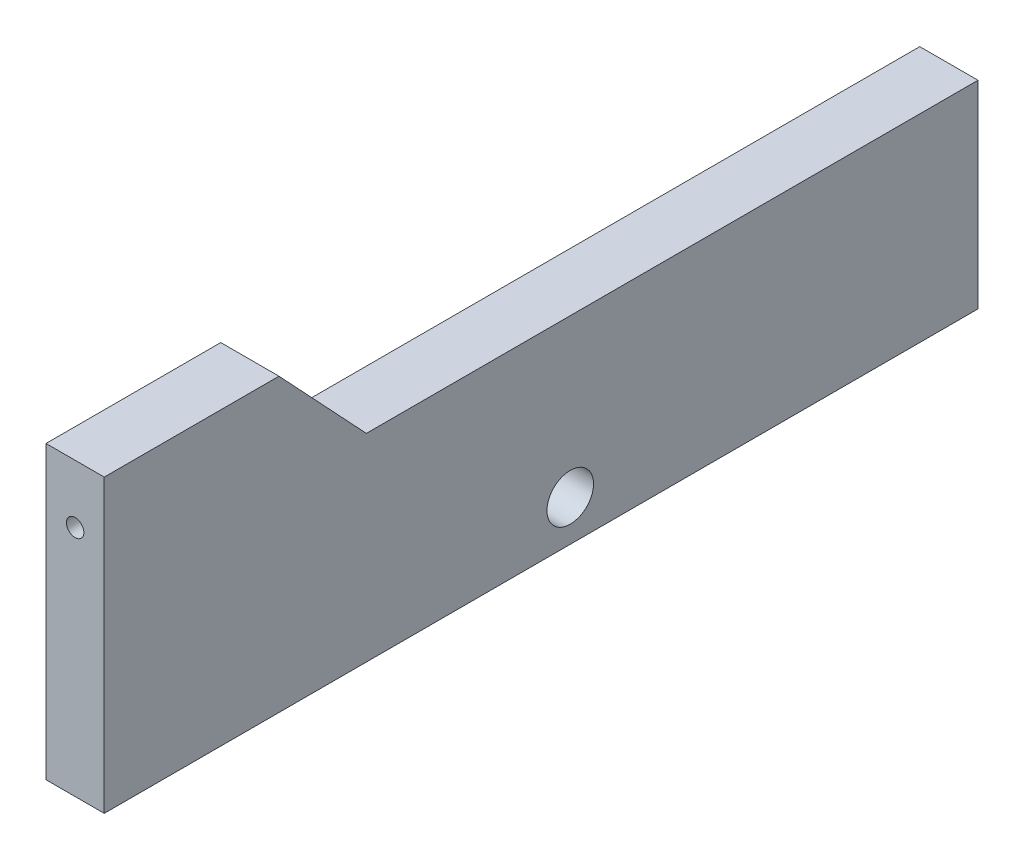
from build123d import *

# Parameters (mm, degrees)
BOSS_EXTRUDE1_DEPTH = 10
SKETCH2_R           = 4
CUT_EXTRUDE1_DEPTH  = 10
SKETCH3_R           = 1.5
CUT_EXTRUDE2_DEPTH  = 20
SKETCH4_R           = 1.5
CUT_EXTRUDE3_DEPTH  = 20


with BuildPart() as part:
    # Sketch1 → Boss-Extrude1 (new body)
    with BuildSketch(Plane(origin=(0, 0, 0), x_dir=(0, 0, -1), z_dir=(1, 0, 0))):
        Polygon((0, 0), (0, 50), (30, 50), (45, 34), (150, 34), (150, 0), align=None)
    extrude(amount=BOSS_EXTRUDE1_DEPTH)

    # Sketch2 → Cut-Extrude1 (cut)
    with BuildSketch(Plane(origin=(10, 0, 0), x_dir=(0, 0, -1), z_dir=(1, 0, 0))):
        with Locations((80, 7)):
            Circle(SKETCH2_R)
    extrude(amount=-CUT_EXTRUDE1_DEPTH, mode=Mode.SUBTRACT)

    # Sketch3 → Cut-Extrude2 (cut)
    with BuildSketch(Plane.XY):
        with Locations((5, 40)):
            Circle(SKETCH3_R)
    extrude(amount=-CUT_EXTRUDE2_DEPTH, mode=Mode.SUBTRACT)

    # Sketch4 → Cut-Extrude3 (cut)
    with BuildSketch(Plane.XZ):
        with Locations((5, -130)):
            Circle(SKETCH4_R)
    extrude(amount=-CUT_EXTRUDE3_DEPTH, mode=Mode.SUBTRACT)


solid = part.part
